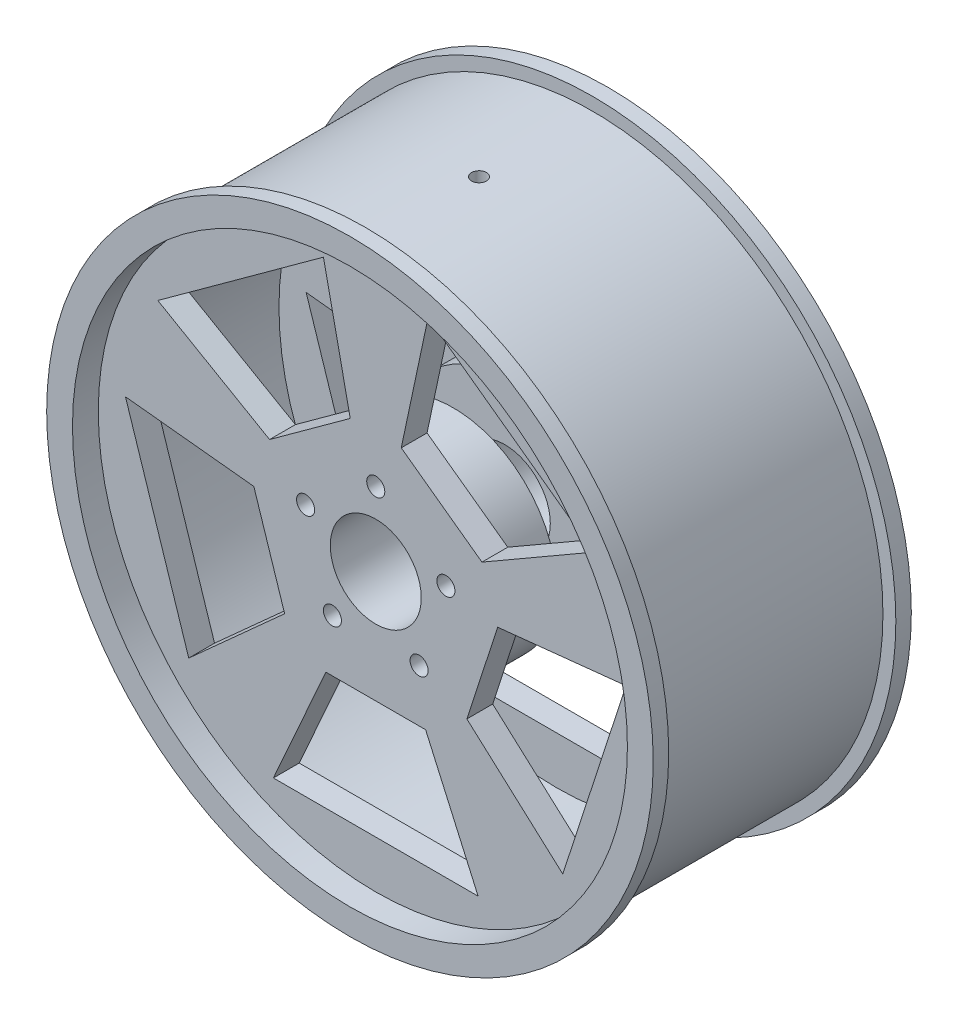
from build123d import *

# Parameters (mm, degrees)
F_02_WINDOW_1_DEPTH         = 378.955023779
F_02_WINDOW_2_DEPTH         = 378.955023779
F_02_WINDOW_3_DEPTH         = 378.955023779
F_02_WINDOW_4_DEPTH         = 378.955023779
F_02_WINDOW_5_DEPTH         = 378.955023779
SKETCH_7_R                  = 35.25
F_03_BORE_D70_5_DEPTH       = 378.955023779
SKETCH_8_R                  = 7
F_04_BOLT_HOLE_D14_1_DEPTH  = 378.955023779
SKETCH_9_R                  = 7
F_04_BOLT_HOLE_D14_2_DEPTH  = 378.955023779
SKETCH_10_R                 = 7
F_04_BOLT_HOLE_D14_3_DEPTH  = 378.955023779
SKETCH_11_R                 = 7
F_04_BOLT_HOLE_D14_4_DEPTH  = 378.955023779
SKETCH_12_R                 = 7
F_04_BOLT_HOLE_D14_5_DEPTH  = 378.955023779
SKETCH_13_R                 = 5.75
F_05_VALVE_HOLE_D11_5_DEPTH = 20


with BuildPart() as part:
    # 草图1 → 01_REVOLVE_WHEEL (revolve)
    with BuildSketch(Plane(origin=(0, 0, 0), x_dir=(0, 0, -1), z_dir=(1, 0, 0))):
        Polygon((0, 0), (0, 215), (-20, 215), (-20, 235), (-8, 235), (-8, 225), (168, 225), (168, 235), (180, 235), (180, 215), (160, 215), (160, 0), (100, 0), (100, 80), (140, 80), (140, 215), (20, 215), (20, 80), (60, 80), (60, 0), align=None)
    revolve(axis=Axis((0, 0, 40), (0, 0, -1)))

    # 草图2 → 02_WINDOW_1 (cut, through all)
    with BuildSketch(Plane.XY):
        Polygon((-19.751610628, 92.92402207), (-40.542779709, 190.738782143), (-168.874953738, 97.5), (-82.27241336, 47.5), align=None)
    extrude(amount=-F_02_WINDOW_1_DEPTH, mode=Mode.SUBTRACT)

    # 草图3 → 02_WINDOW_2 (cut, through all)
    with BuildSketch(Plane.XY):
        Polygon((-94.47958006, 9.93020401), (-193.931769597, 20.383050337), (-144.913240968, -130.48046824), (-70.59875842, -63.567407604), align=None)
    extrude(amount=-F_02_WINDOW_2_DEPTH, mode=Mode.SUBTRACT)

    # 草图4 → 02_WINDOW_3 (cut, through all)
    with BuildSketch(Plane.XY):
        Polygon((-38.639981092, -86.786818476), (-79.3136454, -178.14136424), (79.3136454, -178.14136424), (38.639981092, -86.786818476), align=None)
    extrude(amount=-F_02_WINDOW_3_DEPTH, mode=Mode.SUBTRACT)

    # 草图5 → 02_WINDOW_4 (cut, through all)
    with BuildSketch(Plane.XY):
        Polygon((70.59875842, -63.567407604), (144.913240968, -130.48046824), (193.931769597, 20.383050337), (94.47958006, 9.93020401), align=None)
    extrude(amount=-F_02_WINDOW_4_DEPTH, mode=Mode.SUBTRACT)

    # 草图6 → 02_WINDOW_5 (cut, through all)
    with BuildSketch(Plane.XY):
        Polygon((82.27241336, 47.5), (168.874953738, 97.5), (40.542779709, 190.738782143), (19.751610628, 92.92402207), align=None)
    extrude(amount=-F_02_WINDOW_5_DEPTH, mode=Mode.SUBTRACT)

    # 草图7 → 03_BORE_D70.5 (cut, through all)
    with BuildSketch(Plane.XY):
        Circle(SKETCH_7_R)
    extrude(amount=-F_03_BORE_D70_5_DEPTH, mode=Mode.SUBTRACT)

    # 草图8 → 04_BOLT_HOLE_D14_1 (cut, through all)
    with BuildSketch(Plane.XY):
        with Locations((0, 57.15)):
            Circle(SKETCH_8_R)
    extrude(amount=-F_04_BOLT_HOLE_D14_1_DEPTH, mode=Mode.SUBTRACT)

    # 草图9 → 04_BOLT_HOLE_D14_2 (cut, through all)
    with BuildSketch(Plane.XY):
        with Locations((-54.352879906, 17.660321229)):
            Circle(SKETCH_9_R)
    extrude(amount=-F_04_BOLT_HOLE_D14_2_DEPTH, mode=Mode.SUBTRACT)

    # 草图10 → 04_BOLT_HOLE_D14_3 (cut, through all)
    with BuildSketch(Plane.XY):
        with Locations((-33.591927169, -46.235321229)):
            Circle(SKETCH_10_R)
    extrude(amount=-F_04_BOLT_HOLE_D14_3_DEPTH, mode=Mode.SUBTRACT)

    # 草图11 → 04_BOLT_HOLE_D14_4 (cut, through all)
    with BuildSketch(Plane.XY):
        with Locations((33.591927169, -46.235321229)):
            Circle(SKETCH_11_R)
    extrude(amount=-F_04_BOLT_HOLE_D14_4_DEPTH, mode=Mode.SUBTRACT)

    # 草图12 → 04_BOLT_HOLE_D14_5 (cut, through all)
    with BuildSketch(Plane.XY):
        with Locations((54.352879906, 17.660321229)):
            Circle(SKETCH_12_R)
    extrude(amount=-F_04_BOLT_HOLE_D14_5_DEPTH, mode=Mode.SUBTRACT)

    # 草图13 → 05_VALVE_HOLE_D11.5 (cut)
    with BuildSketch(Plane(origin=(0, 225, 0), x_dir=(1, 0, 0), z_dir=(0, 1, 0))):
        with Locations((0, 80)):
            Circle(SKETCH_13_R)
    extrude(amount=-F_05_VALVE_HOLE_D11_5_DEPTH, mode=Mode.SUBTRACT)


solid = part.part
